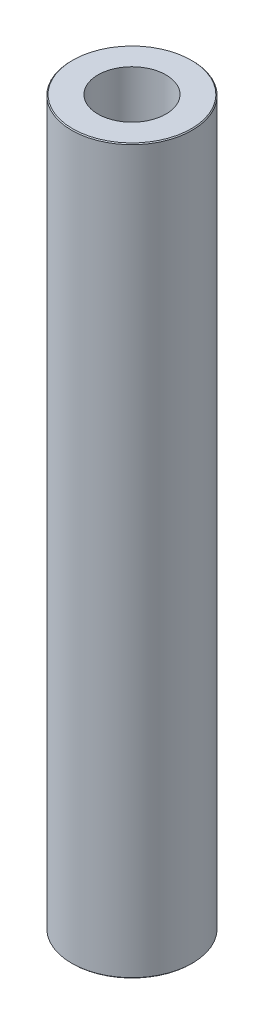
from build123d import *

# Parameters (mm, degrees)
SKETCH1_R           = 50
BOSS_EXTRUDE1_DEPTH = 600
SKETCH2_R           = 28.209552943
CUT_EXTRUDE1_DEPTH  = 605.15229868
CHAMFER1_SIZE       = 0.748408781


with BuildPart() as part:
    # Sketch1 → Boss-Extrude1 (new body)
    with BuildSketch(Plane(origin=(0, 0, 0), x_dir=(1, 0, 0), z_dir=(0, 1, 0))):
        Circle(SKETCH1_R)
    extrude(amount=BOSS_EXTRUDE1_DEPTH)

    # Sketch2 → Cut-Extrude1 (cut, through all)
    with BuildSketch(Plane(origin=(0, 0, 0), x_dir=(1, 0, 0), z_dir=(0, 1, 0))):
        Circle(SKETCH2_R)
    extrude(amount=CUT_EXTRUDE1_DEPTH, mode=Mode.SUBTRACT)

    # Chamfer1
    chamfer1_edges = [part.edges().sort_by_distance(p)[0] for p in [
        (-50, 600, 0),
        (-50, 0, 0),
    ]]
    chamfer(chamfer1_edges, length=CHAMFER1_SIZE)


solid = part.part
